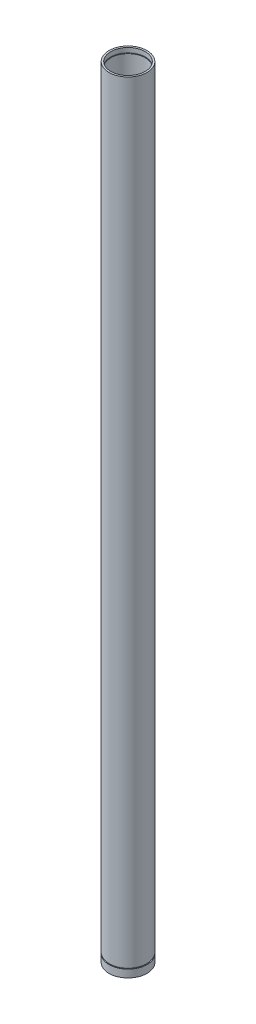
from build123d import *

# Parameters (mm, degrees)
SKETCH1_R           = 27.051
SKETCH1_R_2         = 24.511
BOSS_EXTRUDE1_DEPTH = 1111.25
SKETCH2_W           = 2.54
SKETCH2_H           = 1.397
SKETCH11_W          = 1.796741038
SKETCH11_H          = 1.524


with BuildPart() as part:
    # Sketch1 → Boss-Extrude1 (new body)
    with BuildSketch(Plane(origin=(0, 0, 0), x_dir=(1, 0, 0), z_dir=(0, 1, 0))):
        Circle(SKETCH1_R)
        Circle(SKETCH1_R_2, mode=Mode.SUBTRACT)
    extrude(amount=BOSS_EXTRUDE1_DEPTH)

    # Sketch2 → Cut-Revolve1 (revolve, cut)
    with BuildSketch(Plane.XY):
        with Locations((24.003, 6.9215)):
            Rectangle(SKETCH2_W, SKETCH2_H)
    cut_revolve1 = revolve(axis=Axis((0, 1111.25, 0), (0, -1, 0)), mode=Mode.SUBTRACT)

    # Mirror1: Cut-Revolve1 across plane
    add(cut_revolve1.mirror(Plane(origin=(0, 555.625, 0), x_dir=(0, 0, 1), z_dir=(0, -1, 0))), mode=Mode.SUBTRACT)

    # Sketch11 → Cut-Revolve3 (revolve, cut)
    with BuildSketch(Plane.XY):
        with Locations((26.806370519, 11.684)):
            Rectangle(SKETCH11_W, SKETCH11_H)
    revolve(axis=Axis((0, 1111.25, 0), (0, -1, 0)), mode=Mode.SUBTRACT)


solid = part.part
